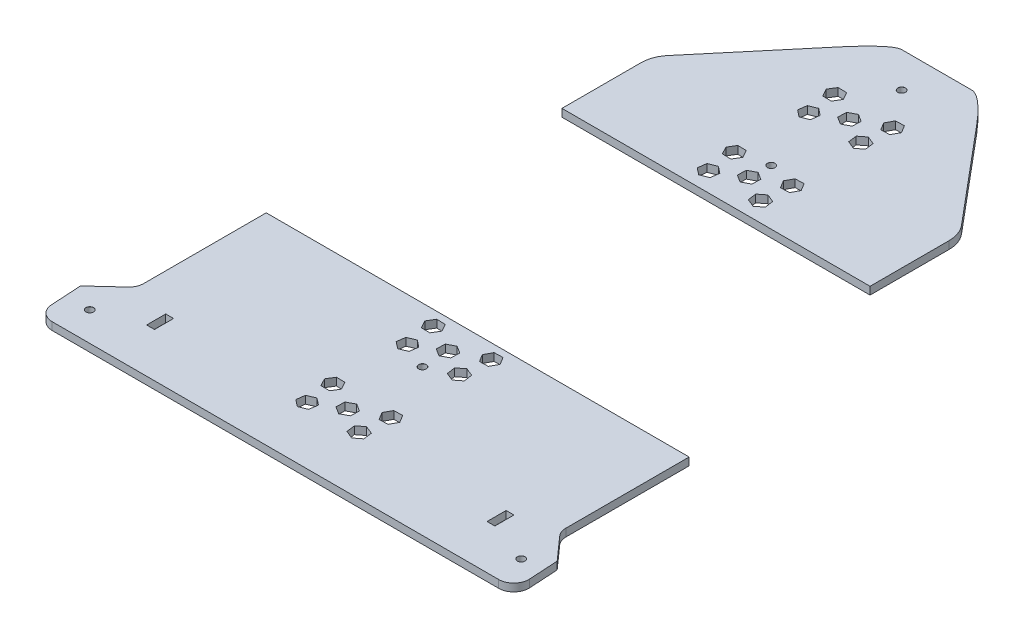
from build123d import *

# Parameters (mm, degrees)
BOSS_EXTRUDE1_DEPTH            = 3.06
FILLET1_R                      = 6
CUT_EXTRUDE1_DEPTH             = 5
SKETCH6_W                      = 200
SKETCH6_H                      = 95
CUT_EXTRUDE3_DEPTH             = 5
F_2_0MM_DOWEL_HOLE1_AT_2_COUNT = 2
F_2_0MM_DOWEL_HOLE1_AT_2_PITCH = 252.736106477
F_2_0MM_DOWEL_HOLE1_AT_3_COUNT = 2
F_2_0MM_DOWEL_HOLE1_AT_3_PITCH = 252.736106477
SKETCH9_W                      = 3.12
SKETCH9_H                      = 7.62
CUT_EXTRUDE5_DEPTH             = 3.06
F_3_0MM_DOWEL_HOLE1_AT_2_COUNT = 2
F_3_0MM_DOWEL_HOLE1_AT_2_PITCH = 139


with BuildPart() as part:
    # Sketch1 → Boss-Extrude1 (new body)
    with BuildSketch(Plane(origin=(0, 0, 0), x_dir=(1, 0, 0), z_dir=(0, 1, 0))):
        with BuildLine():
            Line((17.704500221, 135), (-17.704500221, 135))
            Line((-17.704500221, 135), (-58.606590997, 86.254786373))
            ThreePointArc((-58.606590997, 86.254786373), (-60.690369129, 82.645576777), (-61.41405768, 78.541335057))
            Line((-61.41405768, 78.541335057), (-61.41405768, 44.541335057))
            ThreePointArc((-61.41405768, 44.541335057), (-62.583034268, 39.375201895), (-65.862212987, 35.215583519))
            Line((-65.862212987, 35.215583519), (-100, 7.571348668))
            Line((-100, 7.571348668), (-100, -28.428651332))
            Line((-100, -28.428651332), (-84.293965065, -31.481595258))
            Line((-84.293965065, -31.481595258), (-84.293965065, -99.413076208))
            Line((-84.293965065, -99.413076208), (-96.065162231, -110.25))
            Line((-96.065162231, -110.25), (-95, -128.25))
            Line((-95, -128.25), (95, -128.25))
            Line((95, -128.25), (93.934837769, -110.25))
            Line((93.934837769, -110.25), (84.293965065, -99.413076208))
            Line((84.293965065, -99.413076208), (84.293965065, -31.481595258))
            Line((84.293965065, -31.481595258), (100, -28.428651332))
            Line((100, -28.428651332), (100, 7.571348668))
            Line((100, 7.571348668), (65.862212987, 35.215583519))
            ThreePointArc((65.862212987, 35.215583519), (62.583034268, 39.375201895), (61.41405768, 44.541335057))
            Line((61.41405768, 44.541335057), (61.41405768, 78.541335057))
            ThreePointArc((61.41405768, 78.541335057), (60.690369129, 82.645576777), (58.606590997, 86.254786373))
            Line((58.606590997, 86.254786373), (17.704500221, 135))
        make_face()
    extrude(amount=BOSS_EXTRUDE1_DEPTH)

    # Fillet1
    fillet1_edges = [part.edges().sort_by_distance(p)[0] for p in [
        (100, 1.53, -7.571348668),
        (100, 1.53, 28.428651332),
        (84.293965065, 1.53, 31.481595258),
        (84.293965065, 1.53, 99.413076208),
        (95, 1.53, 128.25),
        (-95, 1.53, 128.25),
        (-84.293965065, 1.53, 99.413076208),
        (-84.293965065, 1.53, 31.481595258),
        (-100, 1.53, 28.428651332),
        (-100, 1.53, -7.571348668),
    ]]
    fillet(fillet1_edges, radius=FILLET1_R)

    # Fillet2
    # an asymmetric fillet: 22, 17 mm, written as the material it takes off along each edge
    with BuildSketch(Plane(origin=(-17.704500221, -36.135666588, -135), x_dir=(-0.6427876096865434, 0, 0.7660444431189746), z_dir=(0, 1, 0))) as fillet2_piece_1:
        with BuildLine():
            Bezier((14.454266635, 0), (0, 0), (-2.398711113, 2.858672587), weights=[1, 0.906307787, 1])
            Line((-2.398711113, 2.858672587), (0, 0))
            Line((0, 0), (14.454266635, 0))
        make_face()
    extrude(amount=75.331333176, mode=Mode.SUBTRACT)

    # Fillet3
    # an asymmetric fillet: 22, 17 mm, written as the material it takes off along each edge
    with BuildSketch(Plane(origin=(17.704500221, -36.135666588, -135), x_dir=(-1, 0, 0), z_dir=(0, 1, 0))) as fillet3_piece_1:
        with BuildLine():
            Bezier((3.731732033, 0), (0, 0), (-9.2910235, 11.072610635), weights=[1, 0.906307787, 1])
            Line((-9.2910235, 11.072610635), (0, 0))
            Line((0, 0), (3.731732033, 0))
        make_face()
    extrude(amount=75.331333176, mode=Mode.SUBTRACT)

    # Sketch3 → Cut-Extrude1 (cut)
    with BuildSketch(Plane(origin=(0, 3.06, 0), x_dir=(1, 0, 0), z_dir=(0, 1, 0))):
        Polygon((-13.704322934, 103.252096223), (-10.241152738, 103.17177068), (-8.44000368, 106.130801276), (-10.102024817, 109.170157415), (-13.565195013, 109.250482958), (-15.366344072, 106.291452362), align=None)
        Polygon((-11.192140398, 91.309145638), (-7.982789671, 92.613012163), (-7.507295841, 96.044324684), (-10.241152738, 98.17177068), (-13.450503465, 96.867904155), (-13.925997294, 93.436591634), align=None)
        Polygon((2.575289815, 98.6910674), (2.710059589, 102.152546435), (-0.220284303, 104), (-3.285397969, 102.38597453), (-3.420167743, 98.924495496), (-0.489823851, 97.07704193), align=None)
        Polygon((13.21588914, 93.436591634), (10.482032243, 91.309145638), (7.272681517, 92.613012163), (6.797187687, 96.044324684), (9.531044584, 98.17177068), (12.740395311, 96.867904155), align=None)
        Polygon((14.656235918, 106.291452362), (12.99421478, 103.252096223), (9.531044584, 103.17177068), (7.729895526, 106.130801276), (9.391916663, 109.170157415), (12.855086859, 109.250482958), align=None)
        Polygon((13.21588914, 53.436591635), (10.482032243, 51.309145638), (7.272681517, 52.613012163), (6.797187687, 56.044324684), (9.531044584, 58.171770681), (12.740395311, 56.867904156), align=None)
        Polygon((-0.489823851, 57.077041931), (2.575289815, 58.6910674), (2.710059589, 62.152546435), (-0.220284303, 64), (-3.285397969, 62.385974531), (-3.420167743, 58.924495496), align=None)
        Polygon((-7.982789671, 52.613012163), (-7.507295841, 56.044324684), (-10.241152738, 58.171770681), (-13.450503465, 56.867904156), (-13.925997294, 53.436591635), (-11.192140398, 51.309145638), align=None)
        Polygon((-10.241152738, 63.171770681), (-8.44000368, 66.130801277), (-10.102024817, 69.170157416), (-13.565195013, 69.250482958), (-15.366344072, 66.291452362), (-13.704322934, 63.252096223), align=None)
        Polygon((9.391916663, 69.170157416), (12.855086859, 69.250482958), (14.656235918, 66.291452362), (12.99421478, 63.252096223), (9.531044584, 63.171770681), (7.729895526, 66.130801277), align=None)
        Polygon((13.21588914, 13.436591635), (10.482032243, 11.309145639), (7.272681517, 12.613012163), (6.797187687, 16.044324685), (9.531044584, 18.171770681), (12.740395311, 16.867904156), align=None)
        Polygon((-0.489823851, 17.077041931), (2.575289815, 18.691067401), (2.710059589, 22.152546436), (-0.220284303, 24.000000001), (-3.285397969, 22.385974531), (-3.420167743, 18.924495496), align=None)
        Polygon((-7.982789671, 12.613012163), (-7.507295841, 16.044324685), (-10.241152738, 18.171770681), (-13.450503465, 16.867904156), (-13.925997294, 13.436591635), (-11.192140398, 11.309145639), align=None)
        Polygon((-10.241152738, 23.171770681), (-8.44000368, 26.130801277), (-10.102024817, 29.170157416), (-13.565195013, 29.250482959), (-15.366344072, 26.291452362), (-13.704322934, 23.252096224), align=None)
        Polygon((9.391916663, 29.170157416), (12.855086859, 29.250482959), (14.656235918, 26.291452362), (12.99421478, 23.252096224), (9.531044584, 23.171770681), (7.729895526, 26.130801277), align=None)
        Polygon((13.21588914, -26.563408365), (10.482032243, -28.690854361), (7.272681517, -27.386987836), (6.797187687, -23.955675315), (9.531044584, -21.828229319), (12.740395311, -23.132095843), align=None)
        Polygon((-0.489823851, -22.922958068), (2.575289815, -21.308932599), (2.710059589, -17.847453564), (-0.220284303, -15.999999999), (-3.285397969, -17.614025468), (-3.420167743, -21.075504503), align=None)
        Polygon((-7.982789671, -27.386987836), (-7.507295841, -23.955675315), (-10.241152738, -21.828229319), (-13.450503465, -23.132095843), (-13.925997294, -26.563408365), (-11.192140398, -28.690854361), align=None)
        Polygon((-10.241152738, -16.828229319), (-8.44000368, -13.869198722), (-10.102024817, -10.829842584), (-13.565195013, -10.749517041), (-15.366344072, -13.708547637), (-13.704322934, -16.747903776), align=None)
        Polygon((9.391916663, -10.829842584), (12.855086859, -10.749517041), (14.656235918, -13.708547637), (12.99421478, -16.747903776), (9.531044584, -16.828229319), (7.729895526, -13.869198722), align=None)
        Polygon((13.21588914, -66.563408364), (10.482032243, -68.690854361), (7.272681517, -67.386987836), (6.797187687, -63.955675315), (9.531044584, -61.828229318), (12.740395311, -63.132095843), align=None)
        Polygon((-0.489823851, -62.922958068), (2.575289815, -61.308932598), (2.710059589, -57.847453564), (-0.220284303, -55.999999998), (-3.285397969, -57.614025468), (-3.420167743, -61.075504503), align=None)
        Polygon((-7.982789671, -67.386987836), (-7.507295841, -63.955675315), (-10.241152738, -61.828229318), (-13.450503465, -63.132095843), (-13.925997294, -66.563408364), (-11.192140398, -68.690854361), align=None)
        Polygon((-10.241152738, -56.828229318), (-8.44000368, -53.869198722), (-10.102024817, -50.829842583), (-13.565195013, -50.749517041), (-15.366344072, -53.708547637), (-13.704322934, -56.747903776), align=None)
        Polygon((9.391916663, -50.829842583), (12.855086859, -50.749517041), (14.656235918, -53.708547637), (12.99421478, -56.747903776), (9.531044584, -56.828229318), (7.729895526, -53.869198722), align=None)
        Polygon((13.21588914, -106.563408364), (10.482032243, -108.69085436), (7.272681517, -107.386987835), (6.797187687, -103.955675314), (9.531044584, -101.828229318), (12.740395311, -103.132095843), align=None)
        Polygon((-0.489823851, -102.922958068), (2.575289815, -101.308932598), (2.710059589, -97.847453563), (-0.220284303, -95.999999998), (-3.285397969, -97.614025468), (-3.420167743, -101.075504502), align=None)
        Polygon((-7.982789671, -107.386987835), (-7.507295841, -103.955675314), (-10.241152738, -101.828229318), (-13.450503465, -103.132095843), (-13.925997294, -106.563408364), (-11.192140398, -108.69085436), align=None)
        Polygon((-10.241152738, -96.828229318), (-8.44000368, -93.869198722), (-10.102024817, -90.829842583), (-13.565195013, -90.74951704), (-15.366344072, -93.708547636), (-13.704322934, -96.747903775), align=None)
        Polygon((9.391916663, -90.829842583), (12.855086859, -90.74951704), (14.656235918, -93.708547636), (12.99421478, -96.747903775), (9.531044584, -96.828229318), (7.729895526, -93.869198722), align=None)
    extrude(amount=-CUT_EXTRUDE1_DEPTH, mode=Mode.SUBTRACT)

    # Sketch6 → Cut-Extrude3 (cut)
    with BuildSketch(Plane(origin=(0, 3.06, 0), x_dir=(1, 0, 0), z_dir=(0, 1, 0))):
        with Locations((0, -0.5)):
            Rectangle(SKETCH6_W, SKETCH6_H)
    extrude(amount=-CUT_EXTRUDE3_DEPTH, mode=Mode.SUBTRACT)


with BuildPart() as cut_extrude3_piece_1:
    # of the separate pieces the step leaves, piece 1, a body of its own (cut_extrude3_pieces)
    add(part.part.solids().sort_by_distance((-84.293965065, 0, 48))[0])


with BuildPart() as cut_extrude3_piece_2:
    # of the separate pieces the step leaves, piece 2, a body of its own (cut_extrude3_pieces)
    add(part.part.solids().sort_by_distance((-61.41405768, 0, -78.541335057))[0])

    # Sketch8 → Ø2.0mm Dowel Hole1 (revolve, cut)
    with BuildSketch(Plane(origin=(0, 3.06, -121), x_dir=(0, 0, 1), z_dir=(1, 0, 0))):
        Polygon((0, 0), (0, 3.17), (1.5, 3.17), (1.5, 0.025), (1.525, 0), align=None)
    f_2_0mm_dowel_hole1 = revolve(axis=Axis((0, 9.41, -121), (0, -1, 0)), mode=Mode.SUBTRACT)


with BuildPart() as cut_extrude3_piece_1_1:
    add(cut_extrude3_piece_1.part)

    # Ø2.0mm Dowel Hole1 at 2: Ø2.0mm Dowel Hole1 ×2
    with Locations(*[Vector(0.34027587588778435, 0, 0.9403256501280827) * (i * F_2_0MM_DOWEL_HOLE1_AT_2_PITCH) for i in range(1, F_2_0MM_DOWEL_HOLE1_AT_2_COUNT)]):
        add(f_2_0mm_dowel_hole1, mode=Mode.SUBTRACT)

    # Ø2.0mm Dowel Hole1 at 3: Ø2.0mm Dowel Hole1 ×2
    with Locations(*[Vector(-0.34027587588778424, 0, 0.9403256501280827) * (i * F_2_0MM_DOWEL_HOLE1_AT_3_PITCH) for i in range(1, F_2_0MM_DOWEL_HOLE1_AT_3_COUNT)]):
        add(f_2_0mm_dowel_hole1, mode=Mode.SUBTRACT)

    # Sketch9 → Cut-Extrude5 (cut)
    with BuildSketch(Plane.XZ):
        with Locations((-67.843392165, 106.75)):
            Rectangle(SKETCH9_W, SKETCH9_H)
    cut_extrude5 = extrude(amount=-CUT_EXTRUDE5_DEPTH, mode=Mode.SUBTRACT)

    # Mirror1: Cut-Extrude5 across plane
    add(cut_extrude5.mirror(Plane(origin=(0, 0, 0), x_dir=(0, 0, 1), z_dir=(1, 0, 0))), mode=Mode.SUBTRACT)

    # Sketch11 → Ø3.0mm Dowel Hole1 (revolve, cut)
    with BuildSketch(Plane(origin=(0, 3.06, 70), x_dir=(0, 0, 1), z_dir=(1, 0, 0))):
        Polygon((0, 0), (0, 3.17), (1.5, 3.17), (1.5, 0.025), (1.525, 0), align=None)
    f_3_0mm_dowel_hole1 = revolve(axis=Axis((0, 9.41, 70), (0, -1, 0)), mode=Mode.SUBTRACT)


with BuildPart() as cut_extrude3_piece_2_1:
    add(cut_extrude3_piece_2.part)

    # Ø3.0mm Dowel Hole1 at 2: Ø3.0mm Dowel Hole1 ×2
    with Locations(*[(0, 0, -i * F_3_0MM_DOWEL_HOLE1_AT_2_PITCH) for i in range(1, F_3_0MM_DOWEL_HOLE1_AT_2_COUNT)]):
        add(f_3_0mm_dowel_hole1, mode=Mode.SUBTRACT)


solid = Compound([cut_extrude3_piece_1_1.part, cut_extrude3_piece_2_1.part])
